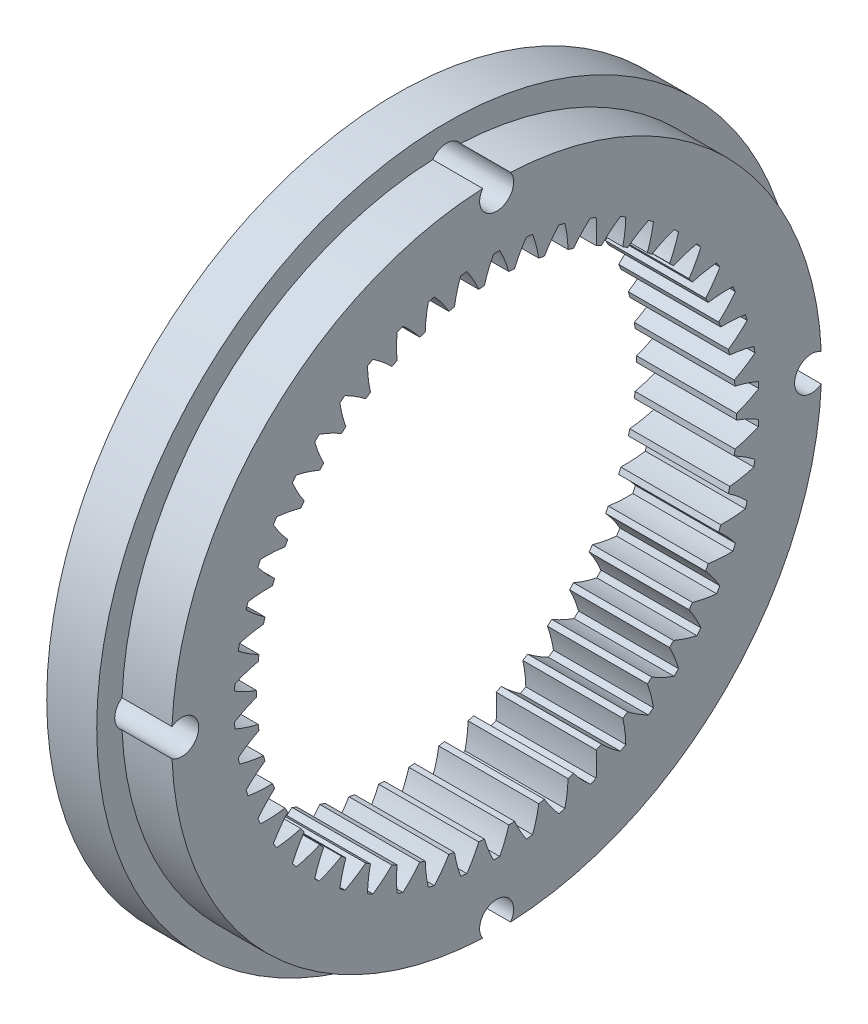
from build123d import *

# Parameters (mm, degrees)
BASPROSKE_W           = 10
BASPROSKE_H           = 11
TOOTHCUT_DEPTH        = 51.497524692
TEETHCUTS_COUNT       = 50
TEETHCUTS_ANGLE       = 352.8
CROQUIS2_R            = 1.7
CORTAR_EXTRUIR1_DEPTH = 10
CROQUIS3_R            = 35
CROQUIS3_R_2          = 32.5
CORTAR_EXTRUIR2_DEPTH = 5


with BuildPart() as part:
    # BasProSke → Base-Revolve (revolve)
    with BuildSketch(Plane(origin=(0, 0, 0), x_dir=(1, 0, 0), z_dir=(0, 1, 0)), mode=Mode.PRIVATE) as base_revolve_sk:
        with Locations((5, 29.5)):
            Rectangle(BASPROSKE_W, BASPROSKE_H)
    revolve(base_revolve_sk.sketch.rotate(Axis((-10, 0, 0), (1, 0, 0)), 180), axis=Axis((-10, 0, 0), (1, 0, 0)))

    # TooCutSke → ToothCut (cut, through all)
    with BuildSketch(Plane(origin=(0, 0, 0), x_dir=(0, 0, -1), z_dir=(1, 0, 0))):
        with BuildLine():
            ThreePointArc((1.228249008, 23.943116955), (0.8277994, 25.118901547), (0.312635126, 26.249138277))
            ThreePointArc((0.312635126, 26.249138277), (0, 26.251), (-0.312635126, 26.249138277))
            ThreePointArc((-0.312635126, 26.249138277), (-0.8277994, 25.118901547), (-1.228249008, 23.943116955))
            ThreePointArc((-1.228249008, 23.943116955), (0, 23.9746), (1.228249008, 23.943116955))
        make_face()
    toothcut = extrude(amount=TOOTHCUT_DEPTH, mode=Mode.SUBTRACT)

    # TeethCuts: ToothCut ×50 about axis
    teethcuts_axis = Axis((-10, 0, 0), (1, 0, 0))
    for i in range(1, TEETHCUTS_COUNT):
        add(toothcut.rotate(teethcuts_axis, i * TEETHCUTS_ANGLE / (TEETHCUTS_COUNT - 1)), mode=Mode.SUBTRACT)

    # Croquis2 → Cortar-Extruir1 (cut)
    with BuildSketch(Plane.ZY):
        with Locations((31.5, 0)):
            Circle(CROQUIS2_R)
        with Locations((0, 31.5)):
            Circle(CROQUIS2_R)
        with Locations((0, -31.5)):
            Circle(CROQUIS2_R)
        with Locations((-31.5, 0)):
            Circle(CROQUIS2_R)
    extrude(amount=-CORTAR_EXTRUIR1_DEPTH, mode=Mode.SUBTRACT)

    # Croquis3 → Cortar-Extruir2 (cut)
    with BuildSketch(Plane(origin=(10, 0, 0), x_dir=(0, 0, -1), z_dir=(1, 0, 0))):
        with Locations(Location((0, 0, 0), (0, 0, 180))):
            Circle(CROQUIS3_R)
        Circle(CROQUIS3_R_2, mode=Mode.SUBTRACT)
    extrude(amount=-CORTAR_EXTRUIR2_DEPTH, mode=Mode.SUBTRACT)


solid = part.part
